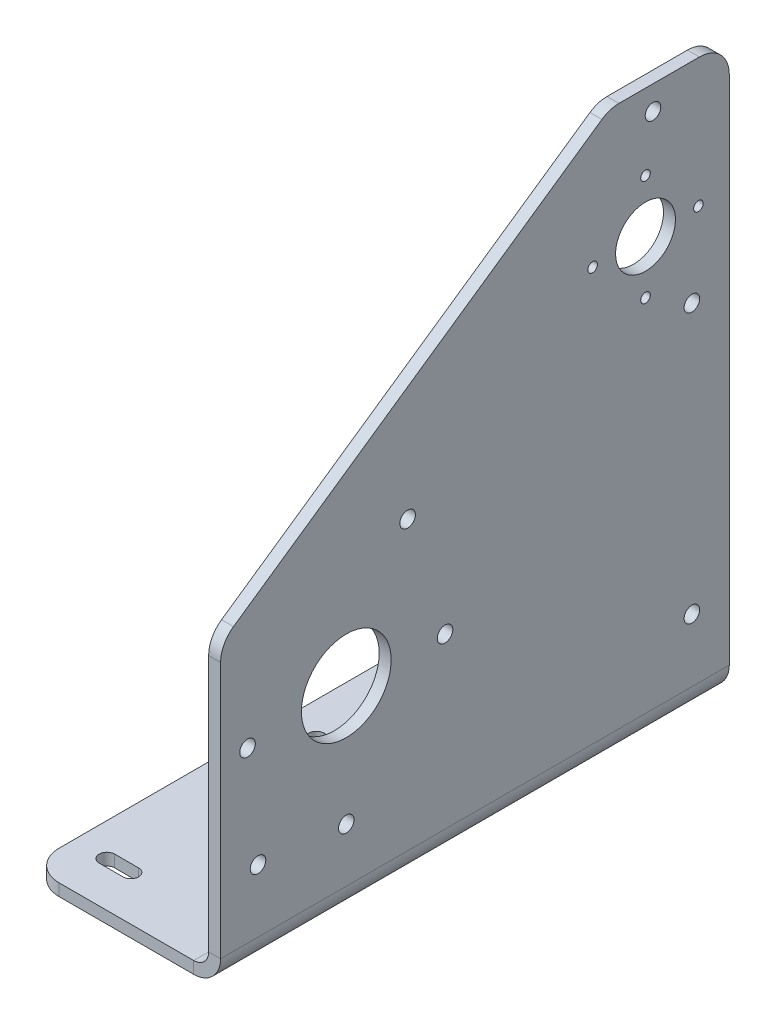
from build123d import *

# Parameters (mm, degrees)
SKETCH1_W                    = 60
SKETCH1_H                    = 170
BASE_FLANGE1_DEPTH           = 4
EDGE_FLANGE1_STRIP_W         = 26
EDGE_FLANGE1_STRIP_H         = 4
EDGE_FLANGE1_STRIP_CUT_DEPTH = 170
EDGE_FLANGE1_DEPTH           = 170
SKETCH15_R                   = 15
SKETCH15_R_2                 = 10
CUT_EXTRUDE4_DEPTH           = 10
CUT_EXTRUDE5_DEPTH           = 10
SKETCH31_R                   = 2.6
CUT_EXTRUDE9_DEPTH           = 7
FILLET1_R                    = 10
SKETCH32_R                   = 1.6
CUT_EXTRUDE10_DEPTH          = 10
F_1_0MM_DOWEL_HOLE2_D        = 5.2
F_1_0MM_DOWEL_HOLE2_DEPTH    = 12.03
F_1_0MM_DOWEL_HOLE2_TIP      = 1.562237609
F_1_0MM_DOWEL_HOLE3_D        = 5.2
F_1_0MM_DOWEL_HOLE3_DEPTH    = 12.03
F_1_0MM_DOWEL_HOLE3_TIP      = 1.562237609
CUT_EXTRUDE11_DEPTH          = 10


# Sheet-metal steps are written as plain solids
with BuildPart() as part:
    # Sketch1 → Base-Flange1 (new body)
    with BuildSketch(Plane(origin=(0, 0, 0), x_dir=(1, 0, 0), z_dir=(0, 1, 0))):
        Rectangle(SKETCH1_W, SKETCH1_H)
    extrude(amount=-BASE_FLANGE1_DEPTH)

    # Edge-Flange1 strip (across the edge) → Edge-Flange1 strip cut (cut)
    with BuildSketch(Plane(origin=(30, 0, 85), x_dir=(-1, 0, 0), z_dir=(0, 0, -1))):
        with Locations((-8, -2)):
            Rectangle(EDGE_FLANGE1_STRIP_W, EDGE_FLANGE1_STRIP_H)
    extrude(amount=EDGE_FLANGE1_STRIP_CUT_DEPTH, mode=Mode.SUBTRACT)

    # Edge-Flange1 section (across the edge) → Edge-Flange1 (add)
    with BuildSketch(Plane(origin=(30, 0, 85), x_dir=(-1, 0, 0), z_dir=(0, 0, -1))):
        with BuildLine():
            Line((-4, 5), (-4, 186))
            Line((-4, 186), (0, 186))
            Line((0, 186), (0, 5))
            ThreePointArc((0, 5), (1.464466094, 1.464466094), (5, 0))
            Line((5, 0), (5, -4))
            ThreePointArc((5, -4), (-1.363961031, -1.363961031), (-4, 5))
        make_face()
    extrude(amount=EDGE_FLANGE1_DEPTH)

    # Sketch15 → Cut-Extrude4 (cut)
    with BuildSketch(Plane(origin=(34, 0, 0), x_dir=(0, 0, -1), z_dir=(1, 0, 0))):
        with Locations(Location((-43, 63, 0), (0, 0, 90))):
            Circle(SKETCH15_R)
        with Locations(Location((57, 143, 0), (0, 0, 90))):
            Circle(SKETCH15_R_2)
    extrude(amount=-CUT_EXTRUDE4_DEPTH, mode=Mode.SUBTRACT)

    # Sketch16 → Cut-Extrude5 (cut)
    with BuildSketch(Plane(origin=(34, 0, 0), x_dir=(0, 0, -1), z_dir=(1, 0, 0))):
        Polygon((-85, 186), (-85, 96), (45, 186), align=None)
    extrude(amount=-CUT_EXTRUDE5_DEPTH, mode=Mode.SUBTRACT)

    # Sketch31 → Cut-Extrude9 (cut)
    with BuildSketch(Plane.ZY.offset(-30)):
        with Locations(Location((76, 61.5, 0), (0, 0, 270))):
            Circle(SKETCH31_R)
        with Locations(Location((10, 61.5, 0), (0, 0, 270))):
            Circle(SKETCH31_R)
        with Locations(Location((43, 23, 0), (0, 0, 270))):
            Circle(SKETCH31_R)
    extrude(amount=-CUT_EXTRUDE9_DEPTH, mode=Mode.SUBTRACT)

    # Fillet1
    fillet1_edges = [part.edges().sort_by_distance(p)[0] for p in [
        (32, 186, -85),
        (32, 186, -45),
        (32, 96, 85),
        (-30, -2, 85),
        (-30, -2, -85),
    ]]
    fillet(fillet1_edges, radius=FILLET1_R)

    # Sketch32 → Cut-Extrude10 (cut)
    with BuildSketch(Plane.ZY.offset(-30)):
        with Locations(Location((-74.67766953, 143, 0), (0, 0, 270))):
            Circle(SKETCH32_R)
        with Locations(Location((-57, 125.32233047, 0), (0, 0, 270))):
            Circle(SKETCH32_R)
        with Locations(Location((-39.32233047, 143, 0), (0, 0, 270))):
            Circle(SKETCH32_R)
        with Locations(Location((-57, 160.67766953, 0), (0, 0, 270))):
            Circle(SKETCH32_R)
    extrude(amount=-CUT_EXTRUDE10_DEPTH, mode=Mode.SUBTRACT)

    # Ø1.0mm Dowel Hole2
    with Locations(Plane(origin=(34, 0, 0), x_dir=(0, 0, -1), z_dir=(1, 0, 0))):
        with Locations((-72.5, 26), (72.5, 26), (72.5, 116), (-22.5, 101), (59.5, 178)):
            Hole(F_1_0MM_DOWEL_HOLE2_D / 2, depth=F_1_0MM_DOWEL_HOLE2_DEPTH)
            with Locations((0, 0, -(F_1_0MM_DOWEL_HOLE2_DEPTH + F_1_0MM_DOWEL_HOLE2_TIP / 2))):  # 118° drill point
                Cone(0, F_1_0MM_DOWEL_HOLE2_D / 2, F_1_0MM_DOWEL_HOLE2_TIP, mode=Mode.SUBTRACT)

    # Ø1.0mm Dowel Hole3
    with Locations(Plane(origin=(0, 0, 0), x_dir=(1, 0, 0), z_dir=(0, 1, 0))):
        with Locations((-15, 70), (-15, 0), (-15, -70)):
            Hole(F_1_0MM_DOWEL_HOLE3_D / 2, depth=F_1_0MM_DOWEL_HOLE3_DEPTH)
            with Locations((0, 0, -(F_1_0MM_DOWEL_HOLE3_DEPTH + F_1_0MM_DOWEL_HOLE3_TIP / 2))):  # 118° drill point
                Cone(0, F_1_0MM_DOWEL_HOLE3_D / 2, F_1_0MM_DOWEL_HOLE3_TIP, mode=Mode.SUBTRACT)

    # Sketch40 → Cut-Extrude11 (cut)
    with BuildSketch(Plane(origin=(0, 0, 0), x_dir=(1, 0, 0), z_dir=(0, 1, 0))):
        with BuildLine():
            Line((-19, -72.6), (-11, -72.6))
            ThreePointArc((-11, -72.6), (-8.4, -70), (-11, -67.4))
            Line((-11, -67.4), (-19, -67.4))
            ThreePointArc((-19, -67.4), (-21.6, -70), (-19, -72.6))
        make_face()
        with BuildLine():
            Line((-19, -2.6), (-11, -2.6))
            ThreePointArc((-11, -2.6), (-8.4, 0), (-11, 2.6))
            Line((-11, 2.6), (-19, 2.6))
            ThreePointArc((-19, 2.6), (-21.6, 0), (-19, -2.6))
        make_face()
        with BuildLine():
            Line((-19, 67.4), (-11, 67.4))
            ThreePointArc((-11, 67.4), (-8.4, 70), (-11, 72.6))
            Line((-11, 72.6), (-19, 72.6))
            ThreePointArc((-19, 72.6), (-21.6, 70), (-19, 67.4))
        make_face()
    extrude(amount=-CUT_EXTRUDE11_DEPTH, mode=Mode.SUBTRACT)


solid = part.part
